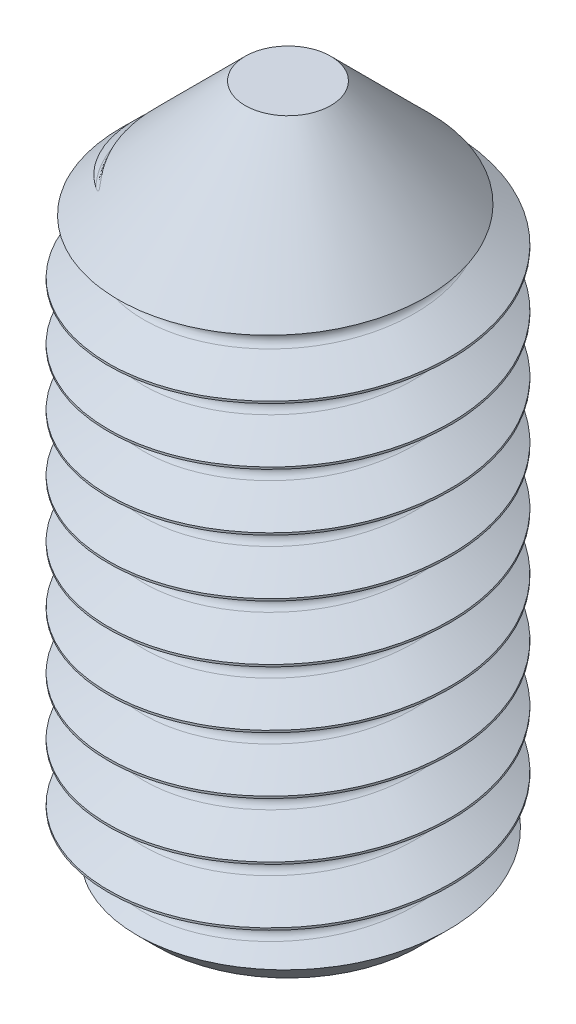
from build123d import *

# Parameters (mm, degrees)
SKETCH1_R              = 3
BOSS_EXTRUDE1_DEPTH    = 6
CUT_EXTRUDE1_DEPTH     = 2.5
CUT_SWEEP1_PITCH       = 0.9999999999999977
CUT_SWEEP1_HEIGHT      = 14.50000000000001
CUT_SWEEP1_RADIUS      = 3.0000000000000004
CUT_SWEEP1_START_ANGLE = -90.0000000000006


with BuildPart() as part:
    # Sketch1 → Boss-Extrude1 (new, symmetric)
    with BuildSketch(Plane(origin=(0, 0, 0), x_dir=(1, 0, 0), z_dir=(0, 1, 0))):
        with Locations(Location((0, 0, 0), (0, 0, 270))):
            Circle(SKETCH1_R)
    extrude(amount=BOSS_EXTRUDE1_DEPTH, both=True)

    # Sketch2 → Cut-Revolve1 (revolve, cut)
    with BuildSketch(Plane.XY, mode=Mode.PRIVATE) as cut_revolve1_sk:
        Polygon((0.7499999999999993, 6), (5.658210769924709, 1.0917892300753096), (5.658210769924709, -2.6417892300753016), (2.3000000000000003, -6), (2.300000000000001, -11.440460971437306), (9.871352994383097, -11.440460971437306), (9.871352994383097, 12.204396091061327), (0.7499999999999984, 12.204396091061327), align=None)
    revolve(cut_revolve1_sk.sketch.rotate(Axis((0, 0, 0), (0, -1, 0)), 270), axis=Axis((0, 0, 0), (0, -1, 0)), mode=Mode.SUBTRACT)

    # Sketch3 → Cut-Extrude1 (cut)
    with BuildSketch(Plane.XZ.offset(6)):
        Polygon((1.54, -0.8891194145520241), (1.5399999999999998, 0.8891194145520247), (4.3e-16, 1.778238829104048), (-1.54, 0.8891194145520245), (-1.54, -0.8891194145520235), (-4.1e-16, -1.7782388291040474), align=None)
    extrude(amount=-CUT_EXTRUDE1_DEPTH, mode=Mode.SUBTRACT)

    # Cut-Sweep1: sweep along a helix
    with BuildLine() as cut_sweep1_path:
        add(Helix(CUT_SWEEP1_PITCH, CUT_SWEEP1_HEIGHT, CUT_SWEEP1_RADIUS, center=(0, -6, 0), direction=(0, 1, 0), mode=Mode.PRIVATE).rotate(Axis((0, -6, 0), (0, 1, 0)), CUT_SWEEP1_START_ANGLE))
    # Sketch5 → Cut-Sweep1 (sweep, cut)
    with BuildSketch(Plane.XY):
        with BuildLine():
            Line((3.022643504401576, -5.63587368209769), (2.3817283546549817, -6.005906216331593))
            ThreePointArc((2.3817283546549817, -6.005906216331593), (2.3095783546549806, -6.130873682097689), (2.3817283546549812, -6.255841147863784))
            Line((2.3817283546549812, -6.255841147863784), (3.022643504401576, -6.625873682097689))
            Line((3.022643504401576, -6.625873682097689), (3.022643504401576, -5.63587368209769))
        make_face()
    sweep(path=cut_sweep1_path.line, is_frenet=True, mode=Mode.SUBTRACT)

    # Cut-Extrude2 cone 1 section (through the dimple's axis) → Cut-Extrude2 (revolve, cut)
    with BuildSketch(Plane(origin=(0, -6, 0), x_dir=(0, 0, -1), z_dir=(1, 0, 0))):
        Polygon((0, 0), (1.778238829, 0), (0, 0.476477658), align=None)
    revolve(axis=Axis((0, -6, 0), (0, 1, 0)), mode=Mode.SUBTRACT)


solid = part.part
